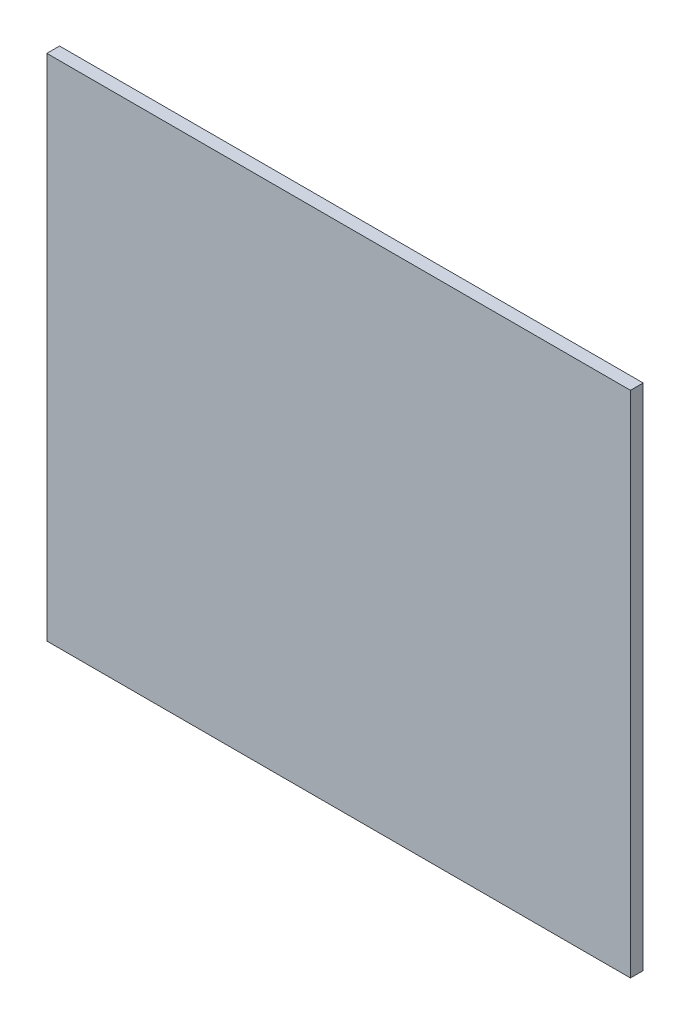
from build123d import *

# Parameters (mm, degrees)
SKETCH2_W           = 546.1
SKETCH2_H           = 476.25
BOSS_EXTRUDE1_DEPTH = 11.90625


with BuildPart() as part:
    # Sketch2 → Boss-Extrude1 (new body)
    with BuildSketch(Plane.XY):
        with Locations((61.601633168, 19.760755995)):
            Rectangle(SKETCH2_W, SKETCH2_H)
    extrude(amount=BOSS_EXTRUDE1_DEPTH)


solid = part.part
